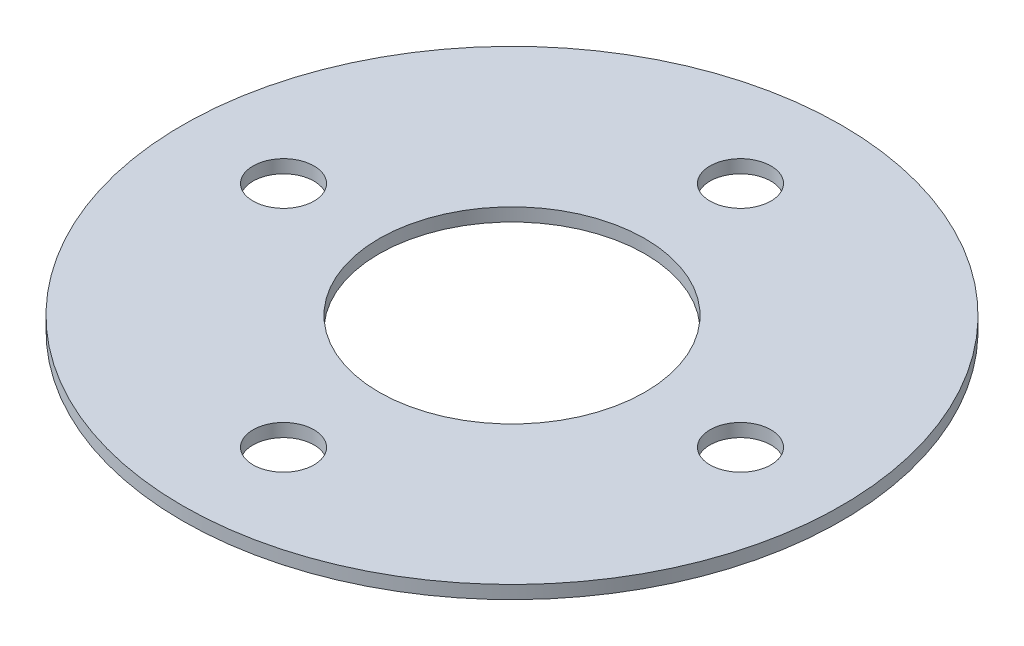
from build123d import *

# Parameters (mm, degrees)
SKETCH1_R           = 21.6364
SKETCH1_R_2         = 8.73125
SKETCH1_R_3         = 2
BOSS_EXTRUDE1_DEPTH = 0.8636


with BuildPart() as part:
    # Sketch1 → Boss-Extrude1 (new body)
    with BuildSketch(Plane(origin=(0, 0, 0), x_dir=(1, 0, 0), z_dir=(0, 1, 0))):
        Circle(SKETCH1_R)
        Circle(SKETCH1_R_2, mode=Mode.SUBTRACT)
        with Locations((0, 15)):
            Circle(SKETCH1_R_3, mode=Mode.SUBTRACT)
        with Locations((15, 0)):
            Circle(SKETCH1_R_3, mode=Mode.SUBTRACT)
        with Locations((0, -15)):
            Circle(SKETCH1_R_3, mode=Mode.SUBTRACT)
        with Locations((-15, 0)):
            Circle(SKETCH1_R_3, mode=Mode.SUBTRACT)
    extrude(amount=BOSS_EXTRUDE1_DEPTH)


solid = part.part
